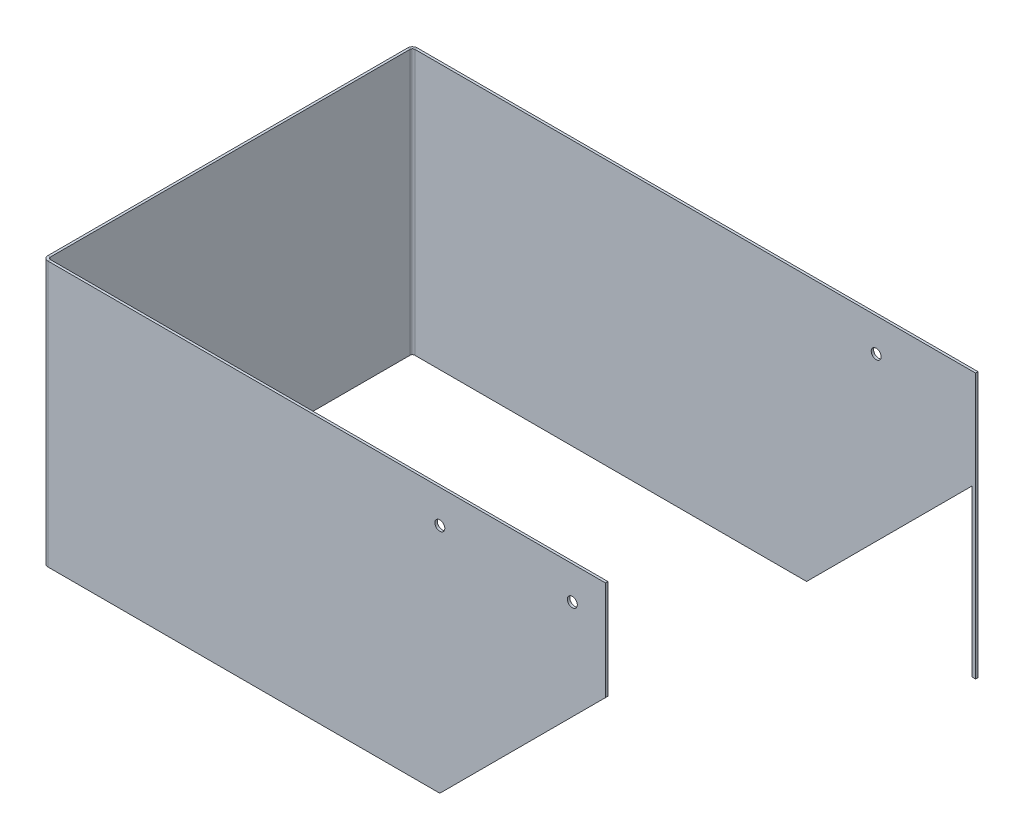
from build123d import *

# Parameters (mm, degrees)
BASE_FLANGE1_DEPTH      = 80
CUT_EXTRUDE1_DEPTH      = 219.463439317
CUT_EXTRUDE1_DEPTH_BACK = 219.463439317
SKETCH7_R               = 1.5
CUT_EXTRUDE3_DEPTH      = 0.7366
SKETCH8_R               = 1.5
CUT_EXTRUDE4_DEPTH      = 0.7366


# Sheet-metal steps are written as plain solids
with BuildPart() as part:
    # Sketch1 → Base-Flange1 (new body)
    with BuildSketch(Plane(origin=(0, 0, 0), x_dir=(1, 0, 0), z_dir=(0, 1, 0))):
        with BuildLine():
            Line((170, 55), (0.7, 55))
            ThreePointArc((0.7, 55), (0.205025253, 54.794974747), (0, 54.3))
            Line((0, 54.3), (0, 0))
            Line((0, 0), (0, -54.3))
            ThreePointArc((0, -54.3), (0.205025253, -54.794974747), (0.7, -55))
            Line((0.7, -55), (169, -55))
            Line((169, -55), (169, -55.7366))
            Line((169, -55.7366), (0.7, -55.7366))
            ThreePointArc((0.7, -55.7366), (-0.315829602, -55.315829602), (-0.7366, -54.3))
            Line((-0.7366, -54.3), (-0.7366, 0))
            Line((-0.7366, 0), (-0.7366, 54.3))
            ThreePointArc((-0.7366, 54.3), (-0.315829602, 55.315829602), (0.7, 55.7366))
            Line((0.7, 55.7366), (170, 55.7366))
            Line((170, 55.7366), (170, 55))
        make_face()
    extrude(amount=BASE_FLANGE1_DEPTH)

    # Sketch6 → Cut-Extrude1 (cut, two sides: drawn at the far end of the back side and taken through both)
    with BuildSketch(Plane.XY.offset(55.7366).offset(-CUT_EXTRUDE1_DEPTH_BACK)):
        Polygon((169, 50), (169, 0), (119, 0), align=None)
    extrude(amount=CUT_EXTRUDE1_DEPTH + CUT_EXTRUDE1_DEPTH_BACK, mode=Mode.SUBTRACT)

    # Sketch7 → Cut-Extrude3 (cut)
    with BuildSketch(Plane.XY.offset(55.7366)):
        with Locations((159, 70)):
            Circle(SKETCH7_R)
        with Locations((119, 70)):
            Circle(SKETCH7_R)
    extrude(amount=-CUT_EXTRUDE3_DEPTH, mode=Mode.SUBTRACT)

    # Sketch8 → Cut-Extrude4 (cut)
    with BuildSketch(Plane.XY.offset(-55.7366)):
        with Locations((140, 70)):
            Circle(SKETCH8_R)
    extrude(amount=CUT_EXTRUDE4_DEPTH, mode=Mode.SUBTRACT)


solid = part.part
